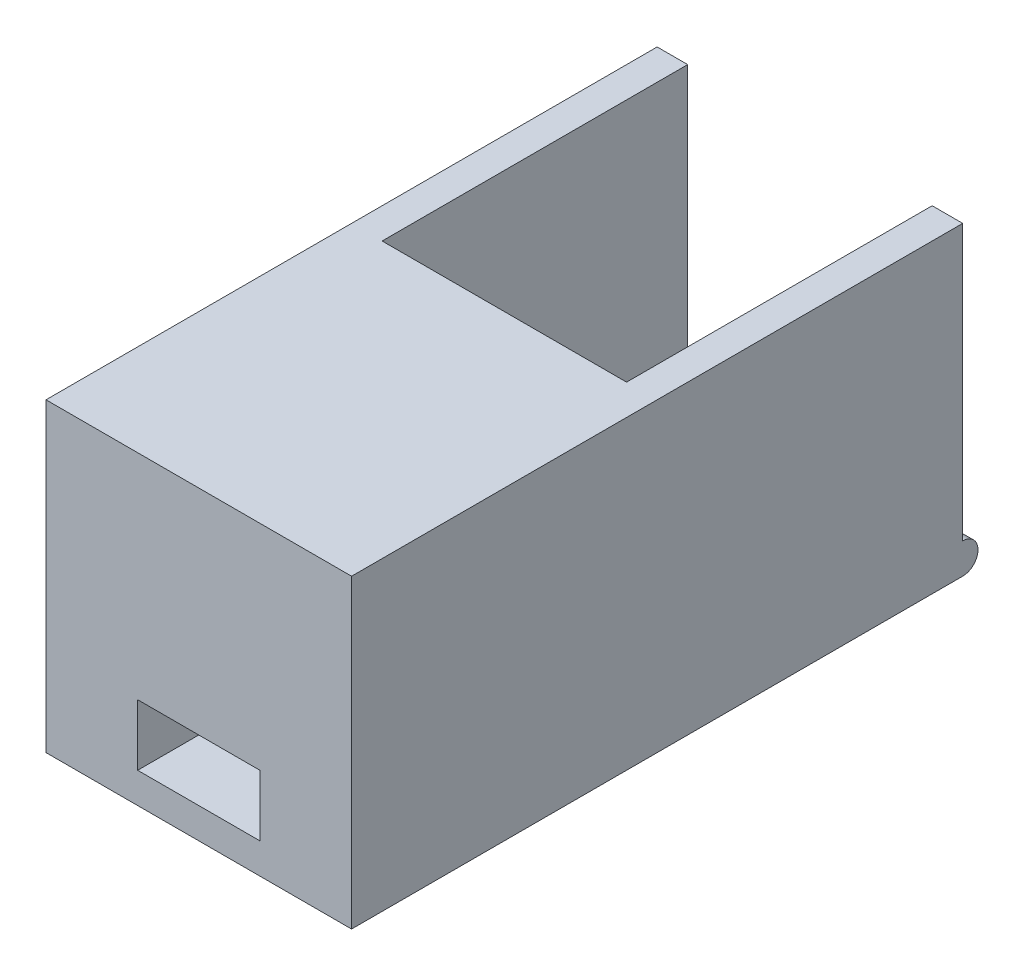
from build123d import *

# Parameters (mm, degrees)
SKETCH_1_W          = 20
SKETCH_1_H          = 40
EXTRUDE_1_DEPTH     = 20
SKETCH_2_W          = 16
SKETCH_2_H          = 20
CUT_EXTRUDE_1_DEPTH = 18
SKETCH_3_W          = 8
SKETCH_3_H          = 38.402735184
CUT_EXTRUDE_2_DEPTH = 20
SKETCH_4_R          = 1
EXTRUDE_2_DEPTH     = 6
EXTRUDE_START       = -6
SKETCH_5_R          = 1
EXTRUDE_3_DEPTH     = 6
SKETCH_6_W          = 8
SKETCH_6_H          = 4
CUT_EXTRUDE_3_DEPTH = 30


with BuildPart() as part:
    # 草图1 → 凸台-拉伸1 (new body)
    with BuildSketch(Plane(origin=(0, 0, 0), x_dir=(1, 0, 0), z_dir=(0, 1, 0))):
        Rectangle(SKETCH_1_W, SKETCH_1_H)
    extrude(amount=EXTRUDE_1_DEPTH)

    # 草图2 → 切除-拉伸1 (cut)
    with BuildSketch(Plane(origin=(0, 20, 0), x_dir=(1, 0, 0), z_dir=(0, 1, 0))):
        with Locations((0, 10)):
            Rectangle(SKETCH_2_W, SKETCH_2_H)
    extrude(amount=-CUT_EXTRUDE_1_DEPTH, mode=Mode.SUBTRACT)

    # 草图3 → 切除-拉伸2 (cut)
    with BuildSketch(Plane.XZ):
        with Locations((0, -23.201367592)):
            Rectangle(SKETCH_3_W, SKETCH_3_H)
    extrude(amount=-CUT_EXTRUDE_2_DEPTH, mode=Mode.SUBTRACT)

    # 草图4 → 凸台-拉伸2 (add)
    with BuildSketch(Plane(origin=(-4, 0, 0), x_dir=(0, 0, -1), z_dir=(1, 0, 0))):
        with Locations((20, 1)):
            Circle(SKETCH_4_R)
    extrude(amount=-EXTRUDE_2_DEPTH)

    # 草图5 → 凸台-拉伸3 (add)
    with BuildSketch(Plane.ZY.offset(-4).offset(EXTRUDE_START)):
        with Locations((-20, 1)):
            Circle(SKETCH_5_R)
    extrude(amount=EXTRUDE_3_DEPTH)

    # 草图6 → 切除-拉伸3 (cut)
    with BuildSketch(Plane(origin=(0, 0, 0), x_dir=(-1, 0, 0), z_dir=(0, 0, -1))):
        with Locations((0, 4)):
            Rectangle(SKETCH_6_W, SKETCH_6_H)
    extrude(amount=-CUT_EXTRUDE_3_DEPTH, mode=Mode.SUBTRACT)


solid = part.part
